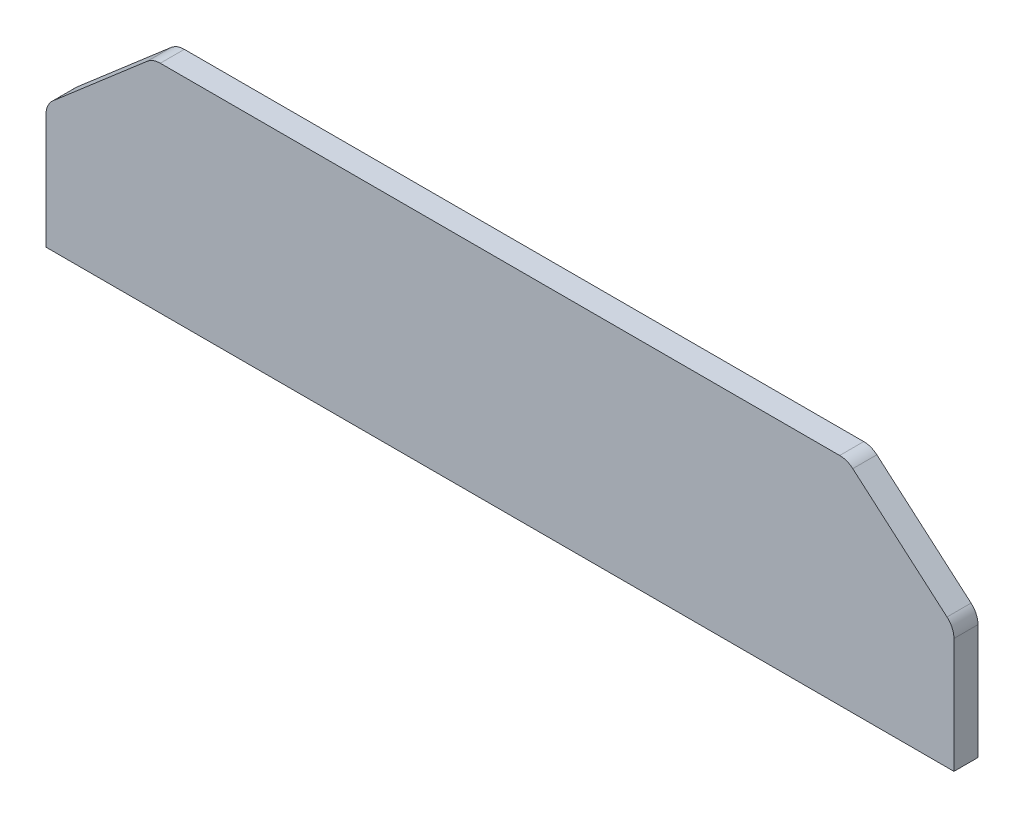
from build123d import *

# Parameters (mm, degrees)
BOSS_EXTRUDE1_DEPTH = 3


with BuildPart() as part:
    # Sketch2 → Boss-Extrude1 (new body)
    with BuildSketch(Plane(origin=(0, 3, 0), x_dir=(1, 0, 0), z_dir=(0, 0, 1))):
        with BuildLine():
            Line((-56.625, -30), (56.625, -30))
            Line((56.625, -30), (56.625, -15.644630074))
            ThreePointArc((56.625, -15.644630074), (56.398076263, -14.603897494), (55.758500558, -13.752098455))
            Line((55.758500558, -13.752098455), (44.005193779, -3.607468381))
            ThreePointArc((44.005193779, -3.607468381), (43.243091796, -3.156783296), (42.371693222, -3))
            Line((42.371693222, -3), (-42.371693222, -3))
            ThreePointArc((-42.371693222, -3), (-43.243091796, -3.156783296), (-44.005193779, -3.607468381))
            Line((-44.005193779, -3.607468381), (-55.758500558, -13.752098455))
            ThreePointArc((-55.758500558, -13.752098455), (-56.398076263, -14.603897494), (-56.625, -15.644630074))
            Line((-56.625, -15.644630074), (-56.625, -30))
        make_face()
    extrude(amount=BOSS_EXTRUDE1_DEPTH)


solid = part.part
